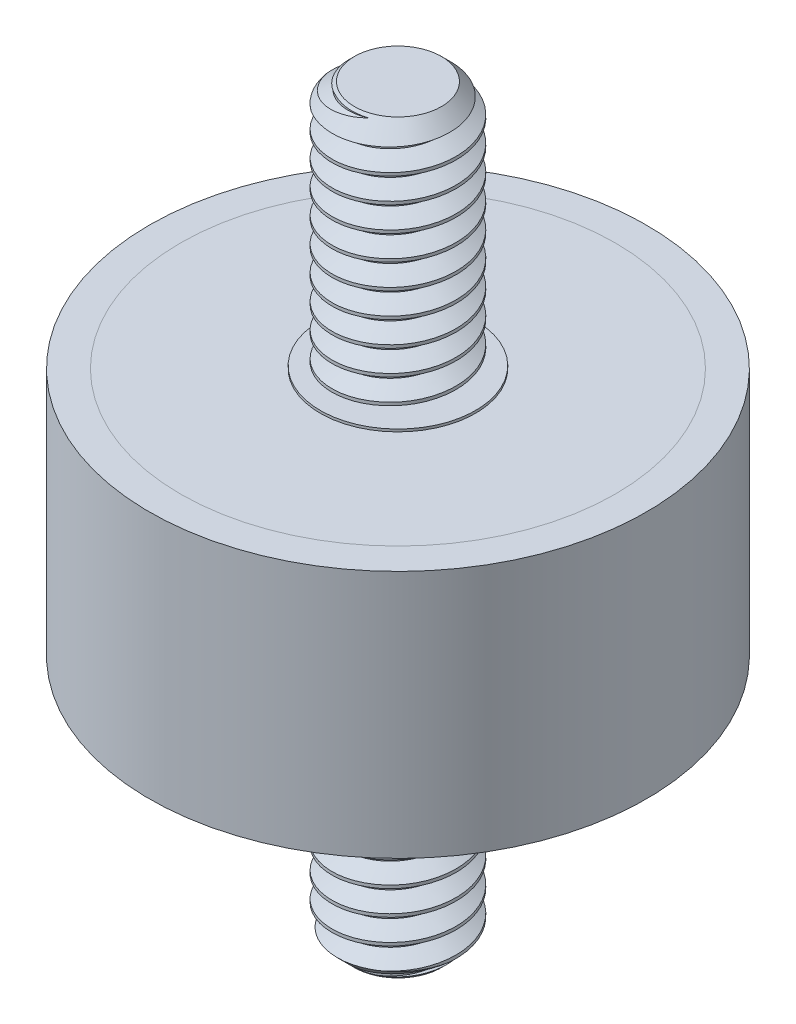
from build123d import *

# Parameters (mm, degrees)
CHAMFER1_SIZE       = 0.9525
SKETCH10_OUTSIDE_W  = 37.872
SKETCH10_OUTSIDE_H  = 37.872
SKETCH10_OUTSIDE_R  = 11.1125
CUT_EXTRUDE1_DEPTH  = 32.108519733
SKETCH11_R          = 12.7
SKETCH11_R_2        = 11.1125
BOSS_EXTRUDE1_DEPTH = 12.7
SPLIT1_START        = -19.05
SPLIT1_2_OUTLINE_R  = 3.175
SPLIT1_2_DEPTH      = 12.573
SPLIT1_START_2      = 6.477
SPLIT1_3_OUTLINE_R  = 3.175
SPLIT1_3_DEPTH      = 12.573
CUT_SWEEP1_PITCH    = 1.27
CUT_SWEEP1_FROM     = 0
CUT_SWEEP2_PITCH    = 1.27
CUT_SWEEP2_FROM     = 0


with BuildPart() as part:
    # Sketch2 → Revolve1 (revolve)
    with BuildSketch(Plane.XY, mode=Mode.PRIVATE) as revolve1_sk:
        Polygon((12.7, -6.35), (12.7, 6.35), (3.96875, 6.35), (3.96875, 6.477), (3.175, 6.477), (3.175, 19.05), (0, 19.05), (0, -19.05), (3.175, -19.05), (3.175, -6.477), (3.96875, -6.477), (3.96875, -6.35), align=None)
    revolve(revolve1_sk.sketch.rotate(Axis((0, 19.05, 0), (0, -1, 0)), 180), axis=Axis((0, 19.05, 0), (0, -1, 0)))

    # Chamfer1
    chamfer1_edges = [part.edges().sort_by_distance(p)[0] for p in [
        (3.175, -19.05, 0),
        (3.175, 19.05, 0),
    ]]
    chamfer(chamfer1_edges, length=CHAMFER1_SIZE)

    # Sketch10 outside → Cut-Extrude1 (cut, through all)
    with BuildSketch(Plane(origin=(0, 6.35, 0), x_dir=(1, 0, 0), z_dir=(0, 1, 0))):
        Rectangle(SKETCH10_OUTSIDE_W, SKETCH10_OUTSIDE_H)
        with Locations(Location((0, 0, 0), (0, 0, 180))):
            Circle(SKETCH10_OUTSIDE_R, mode=Mode.SUBTRACT)
    extrude(amount=-CUT_EXTRUDE1_DEPTH, mode=Mode.SUBTRACT)

    # Split1 2 outline → Split1 2 (cut)
    with BuildSketch(Plane(origin=(0, 0, 0), x_dir=(1, 0, 0), z_dir=(0, 1, 0)).offset(SPLIT1_START)):
        Circle(SPLIT1_2_OUTLINE_R)
    extrude(amount=SPLIT1_2_DEPTH, mode=Mode.SUBTRACT)

    # Split1 3 outline → Split1 3 (cut)
    with BuildSketch(Plane(origin=(0, 0, 0), x_dir=(1, 0, 0), z_dir=(0, 1, 0)).offset(SPLIT1_START_2)):
        Circle(SPLIT1_3_OUTLINE_R)
    extrude(amount=SPLIT1_3_DEPTH, mode=Mode.SUBTRACT)


with BuildPart() as body_2:
    # Sketch11 → Boss-Extrude1 (new body)
    with BuildSketch(Plane(origin=(0, 6.35, 0), x_dir=(1, 0, 0), z_dir=(0, 1, 0))):
        with Locations(Location((0, 0, 0), (0, 0, 180))):
            Circle(SKETCH11_R)
        with Locations(Location((0, 0, 0), (0, 0, 180))):
            Circle(SKETCH11_R_2, mode=Mode.SUBTRACT)
    extrude(amount=-BOSS_EXTRUDE1_DEPTH)


with BuildPart() as body_3:
    # Split1: read off the stored shape, not the designer's step
    # Split1 outline → Split1 (revolve)
    with BuildSketch(Plane.XY):
        Polygon((3.175, -6.477), (0, -6.477), (0, -19.05), (2.2225, -19.05), (3.175, -18.0975), align=None)
    revolve(axis=Axis((0, 0, 0), (0, 1, 0)))

    # Cut-Sweep2: arcs per turn and ends read off the stored shape
    # Cut-Sweep2: the profile of Sketch6 profile screwed along a right-hand helix through 12 turns, 8 arcs to a turn; built about Z, then put on its axis
    cut_sweep2_z = Axis((0, 0, 0), (0, 0, 1))
    cut_sweep2_corners = [(3.1753, 0, -1.269826795), (3.1753, 0, -2.381423205), (2.350110803, 0, -1.905), (2.350110803, 0, -1.74625)]
    with BuildLine(mode=Mode.PRIVATE) as cut_sweep2_profile:
        Line(cut_sweep2_corners[0], cut_sweep2_corners[1])
        Line(cut_sweep2_corners[1], cut_sweep2_corners[2])
        Line(cut_sweep2_corners[2], cut_sweep2_corners[3])
        Line(cut_sweep2_corners[3], cut_sweep2_corners[0])
    cut_sweep2_cap = Face(cut_sweep2_profile.wire())
    cut_sweep2_turn_angles = [0, 22.5, 45, 67.5, 90, 112.5, 135, 157.5, 180, 202.5, 225, 247.5, 270, 292.5, 315, 337.5, 360]
    cut_sweep2_turn_weights = [1, 0.9238795325112867, 1, 0.9238795325112867, 1, 0.9238795325112867, 1, 0.9238795325112867, 1, 0.9238795325112867, 1, 0.9238795325112867, 1, 0.9238795325112867, 1, 0.9238795325112867, 1]
    cut_sweep2_turn_rails = [Edge.make_bspline([Vector(p[0], p[1], 0).rotate(cut_sweep2_z, cut_sweep2_turn_angles[k]) / cut_sweep2_turn_weights[k] + Vector(0, 0, p[2] + CUT_SWEEP2_PITCH * cut_sweep2_turn_angles[k] / 360) for k in range(17)], [0, 0, 0, 1, 1, 2, 2, 3, 3, 4, 4, 5, 5, 6, 6, 7, 7, 8, 8, 8], 2, cut_sweep2_turn_weights) for p in cut_sweep2_corners]
    cut_sweep2_turn_sides = [Face.make_surface_from_curves(cut_sweep2_turn_rails[p[0]], cut_sweep2_turn_rails[p[1]]) for p in [(0, 1), (1, 2), (2, 3), (3, 0)]]
    cut_sweep2 = Plane(origin=(0, -6.477, 0), x_dir=(1, 0, 0), z_dir=(0, -1, 0)) * split(Solid(Shell([*[p.moved(Location((0, 0, CUT_SWEEP2_PITCH * i))) for i in range(12) for p in cut_sweep2_turn_sides], cut_sweep2_cap, cut_sweep2_cap.rotate(cut_sweep2_z, 4320).moved(Location((0, 0, CUT_SWEEP2_PITCH * 4320 / 360)))])), bisect_by=Plane.XY.offset(CUT_SWEEP2_FROM), keep=Keep.TOP, mode=Mode.PRIVATE)
    add(cut_sweep2, mode=Mode.SUBTRACT)


with BuildPart() as body_4:
    # Split1 4 outline → Split1 4 (revolve)
    with BuildSketch(Plane.XY):
        Polygon((0, 19.05), (0, 6.477), (3.175, 6.477), (3.175, 18.0975), (2.2225, 19.05), align=None)
    revolve(axis=Axis((0, 0, 0), (0, 1, 0)))

    # Cut-Sweep1: arcs per turn and ends read off the stored shape
    # Cut-Sweep1: the profile of Sketch4 profile screwed along a right-hand helix through 12 turns, 8 arcs to a turn; built about Z, then put on its axis
    cut_sweep1_z = Axis((0, 0, 0), (0, 0, 1))
    cut_sweep1_corners = [(3.1753, 0, -1.269826795), (3.1753, 0, -2.381423205), (2.350110803, 0, -1.905), (2.350110803, 0, -1.74625)]
    with BuildLine(mode=Mode.PRIVATE) as cut_sweep1_profile:
        Line(cut_sweep1_corners[0], cut_sweep1_corners[1])
        Line(cut_sweep1_corners[1], cut_sweep1_corners[2])
        Line(cut_sweep1_corners[2], cut_sweep1_corners[3])
        Line(cut_sweep1_corners[3], cut_sweep1_corners[0])
    cut_sweep1_cap = Face(cut_sweep1_profile.wire())
    cut_sweep1_turn_angles = [0, 22.5, 45, 67.5, 90, 112.5, 135, 157.5, 180, 202.5, 225, 247.5, 270, 292.5, 315, 337.5, 360]
    cut_sweep1_turn_weights = [1, 0.9238795325112867, 1, 0.9238795325112867, 1, 0.9238795325112867, 1, 0.9238795325112867, 1, 0.9238795325112867, 1, 0.9238795325112867, 1, 0.9238795325112867, 1, 0.9238795325112867, 1]
    cut_sweep1_turn_rails = [Edge.make_bspline([Vector(p[0], p[1], 0).rotate(cut_sweep1_z, cut_sweep1_turn_angles[k]) / cut_sweep1_turn_weights[k] + Vector(0, 0, p[2] + CUT_SWEEP1_PITCH * cut_sweep1_turn_angles[k] / 360) for k in range(17)], [0, 0, 0, 1, 1, 2, 2, 3, 3, 4, 4, 5, 5, 6, 6, 7, 7, 8, 8, 8], 2, cut_sweep1_turn_weights) for p in cut_sweep1_corners]
    cut_sweep1_turn_sides = [Face.make_surface_from_curves(cut_sweep1_turn_rails[p[0]], cut_sweep1_turn_rails[p[1]]) for p in [(0, 1), (1, 2), (2, 3), (3, 0)]]
    cut_sweep1 = Plane(origin=(0, 6.477, 0), x_dir=(-1, 0, 0), z_dir=(0, 1, 0)) * split(Solid(Shell([*[p.moved(Location((0, 0, CUT_SWEEP1_PITCH * i))) for i in range(12) for p in cut_sweep1_turn_sides], cut_sweep1_cap, cut_sweep1_cap.rotate(cut_sweep1_z, 4320).moved(Location((0, 0, CUT_SWEEP1_PITCH * 4320 / 360)))])), bisect_by=Plane.XY.offset(CUT_SWEEP1_FROM), keep=Keep.TOP, mode=Mode.PRIVATE)
    add(cut_sweep1, mode=Mode.SUBTRACT)

    # Combine1: union part, body 3
    add(part.part)
    add(body_3.part)


solid = Compound([body_2.part, body_4.part])
